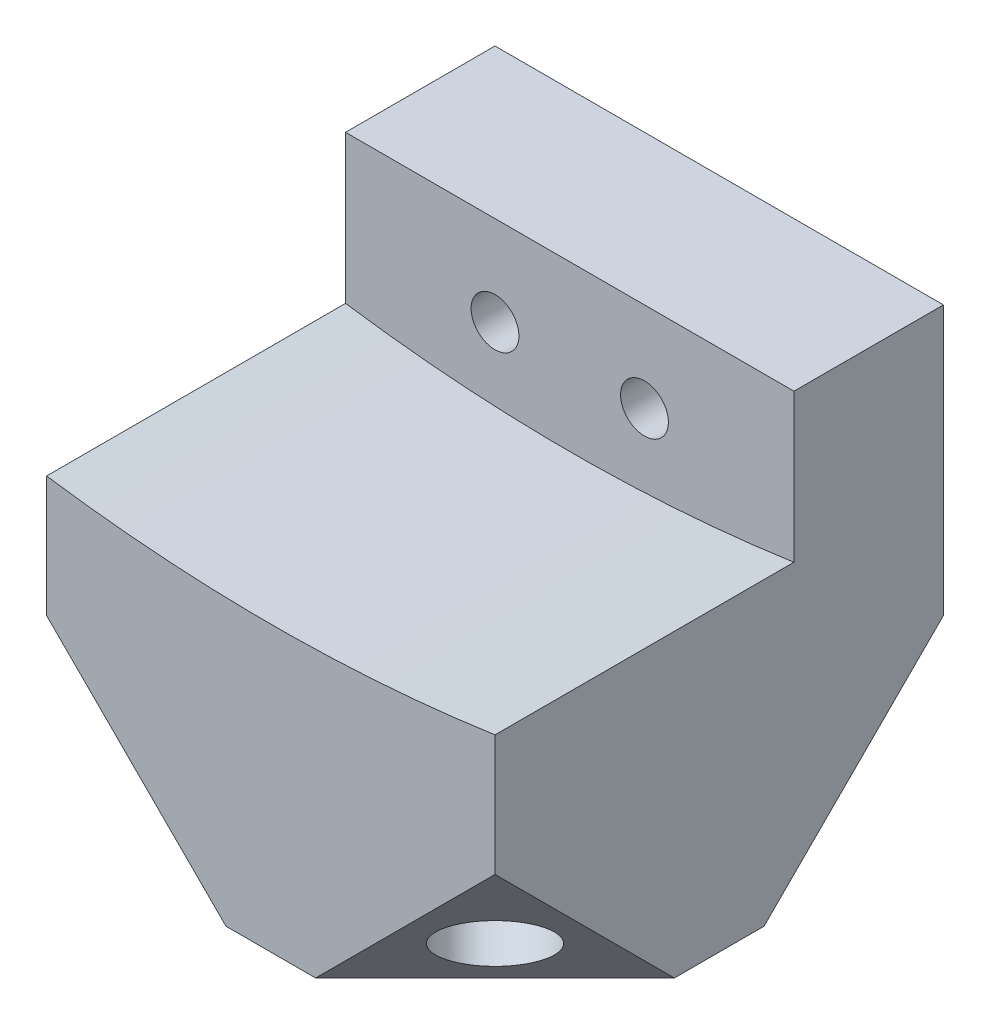
from build123d import *

# Parameters (mm, degrees)
ESQUISSE1_W             = 30
ESQUISSE1_H             = 30
BOSS_EXTRU_1_DEPTH      = 15
CHANFREIN1_START        = 19.052558883
CHANFREIN1_OUTLINE_W    = 17
CHANFREIN1_OUTLINE_H    = 20
CHANFREIN1_DEPTH        = 7.947441117
CHANFREIN2_START        = 19.052558883
CHANFREIN2_OUTLINE_W    = 17
CHANFREIN2_OUTLINE_H    = 20
CHANFREIN2_DEPTH        = 7.947441117
ESQUISSE2_R             = 3.25
ENL_V_MAT_EXTRU_1_DEPTH = 10
CHANFREIN4_START        = -27
CHANFREIN4_OUTLINE_W    = 17
CHANFREIN4_OUTLINE_H    = 20
CHANFREIN4_DEPTH        = 7.947441117
CHANFREIN5_START        = -27
CHANFREIN5_OUTLINE_W    = 17
CHANFREIN5_OUTLINE_H    = 20
CHANFREIN5_DEPTH        = 7.947441117
CHANFREIN3_SIZE         = 8
ESQUISSE3_R             = 3.25
ENL_V_MAT_EXTRU_2_DEPTH = 10
ESQUISSE4_R             = 104
ENL_V_MAT_EXTRU_3_DEPTH = 20
ESQUISSE5_R             = 1.6
ENL_V_MAT_EXTRU_4_DEPTH = 20
ENL_V_MAT_EXTRU_5_DEPTH = 2


with BuildPart() as part:
    # Esquisse1 → Boss.-Extru.1 (new, symmetric)
    with BuildSketch(Plane.XY):
        Rectangle(ESQUISSE1_W, ESQUISSE1_H)
    extrude(amount=BOSS_EXTRU_1_DEPTH, both=True)

    # Chanfrein1: read off the stored shape, not the designer's step
    # Chanfrein1 outline → Chanfrein1 (cut)
    with BuildSketch(Plane(origin=(0, 0, 0), x_dir=(0.8164965809277258, 0.40824829046386313, 0.40824829046386313), z_dir=(0.5773502691896258, -0.5773502691896258, -0.5773502691896258)).offset(CHANFREIN1_START)):
        with Locations((-2.5, 0)):
            Rectangle(CHANFREIN1_OUTLINE_W, CHANFREIN1_OUTLINE_H)
    extrude(amount=CHANFREIN1_DEPTH, mode=Mode.SUBTRACT)

    # Chanfrein2: read off the stored shape, not the designer's step
    # Chanfrein2 outline → Chanfrein2 (cut)
    with BuildSketch(Plane(origin=(0, 0, 0), x_dir=(0.8164965809277258, 0.40824829046386313, -0.40824829046386313), z_dir=(0.5773502691896258, -0.5773502691896258, 0.5773502691896258)).offset(CHANFREIN2_START)):
        with Locations((-2.5, 0)):
            Rectangle(CHANFREIN2_OUTLINE_W, CHANFREIN2_OUTLINE_H)
    extrude(amount=CHANFREIN2_DEPTH, mode=Mode.SUBTRACT)

    # Esquisse2 → Enlèv. mat.-Extru.1 (cut)
    with BuildSketch(Plane(origin=(11, -11, -11), x_dir=(-0.40824829046386296, 0.4082482904638631, -0.816496580927726), z_dir=(0.5773502691896257, -0.5773502691896258, -0.5773502691896258))):
        with Locations(Location((0, 0, 0), (0, 0, 30))):
            Circle(ESQUISSE2_R)
    enl_v_mat_extru_1 = extrude(amount=-ENL_V_MAT_EXTRU_1_DEPTH, mode=Mode.SUBTRACT)

    # Symétrie3: Enlèv. mat.-Extru.1 across plane
    add(enl_v_mat_extru_1.mirror(Plane.XY), mode=Mode.SUBTRACT)

    # Chanfrein4: read off the stored shape, not the designer's step
    # Chanfrein4 outline → Chanfrein4 (cut)
    with BuildSketch(Plane(origin=(0, 0, 0), x_dir=(0.8164965809277258, -0.40824829046386313, 0.40824829046386313), z_dir=(0.5773502691896258, 0.5773502691896258, -0.5773502691896258)).offset(CHANFREIN4_START)):
        with Locations((2.5, 0)):
            Rectangle(CHANFREIN4_OUTLINE_W, CHANFREIN4_OUTLINE_H)
    extrude(amount=CHANFREIN4_DEPTH, mode=Mode.SUBTRACT)

    # Chanfrein5: read off the stored shape, not the designer's step
    # Chanfrein5 outline → Chanfrein5 (cut)
    with BuildSketch(Plane(origin=(0, 0, 0), x_dir=(0.8164965809277258, -0.40824829046386313, -0.40824829046386313), z_dir=(0.5773502691896258, 0.5773502691896258, 0.5773502691896258)).offset(CHANFREIN5_START)):
        with Locations((2.5, 0)):
            Rectangle(CHANFREIN5_OUTLINE_W, CHANFREIN5_OUTLINE_H)
    extrude(amount=CHANFREIN5_DEPTH, mode=Mode.SUBTRACT)

    # Chanfrein3
    chanfrein3_edges = [part.edges().sort_by_distance(p)[0] for p in [
        (-15, -15, 0),
    ]]
    chamfer(chanfrein3_edges, length=CHANFREIN3_SIZE)

    # Esquisse3 → Enlèv. mat.-Extru.2 (cut)
    with BuildSketch(Plane(origin=(-11, -11, 0), x_dir=(0, 0, 1), z_dir=(-0.7071067811865487, -0.7071067811865465, 0))):
        with Locations(Location((0, 0, 0), (0, 0, 270))):
            Circle(ESQUISSE3_R)
    extrude(amount=-ENL_V_MAT_EXTRU_2_DEPTH, mode=Mode.SUBTRACT)

    # Esquisse4 → Enlèv. mat.-Extru.3 (cut)
    with BuildSketch(Plane.XY.offset(15)):
        with Locations((0, 108)):
            Circle(ESQUISSE4_R)
    extrude(amount=-ENL_V_MAT_EXTRU_3_DEPTH, mode=Mode.SUBTRACT)

    # Esquisse5 → Enlèv. mat.-Extru.4 (cut)
    with BuildSketch(Plane.XY.offset(-5)):
        with Locations((-5, 9)):
            Circle(ESQUISSE5_R)
        with Locations((5, 9)):
            Circle(ESQUISSE5_R)
    extrude(amount=-ENL_V_MAT_EXTRU_4_DEPTH, mode=Mode.SUBTRACT)

    # Esquisse6 → Enlèv. mat.-Extru.5 (cut)
    with BuildSketch(Plane(origin=(0, 0, -15), x_dir=(-1, 0, 0), z_dir=(0, 0, -1))):
        Polygon((-3.383419246, 11.8), (-6.616580754, 11.8), (-8.233161507, 9), (-6.616580754, 6.2), (-3.383419246, 6.2), (-1.766838493, 9), align=None)
        Polygon((6.616580754, 11.8), (3.383419246, 11.8), (1.766838493, 9), (3.383419246, 6.2), (6.616580754, 6.2), (8.233161507, 9), align=None)
    extrude(amount=-ENL_V_MAT_EXTRU_5_DEPTH, mode=Mode.SUBTRACT)


solid = part.part
